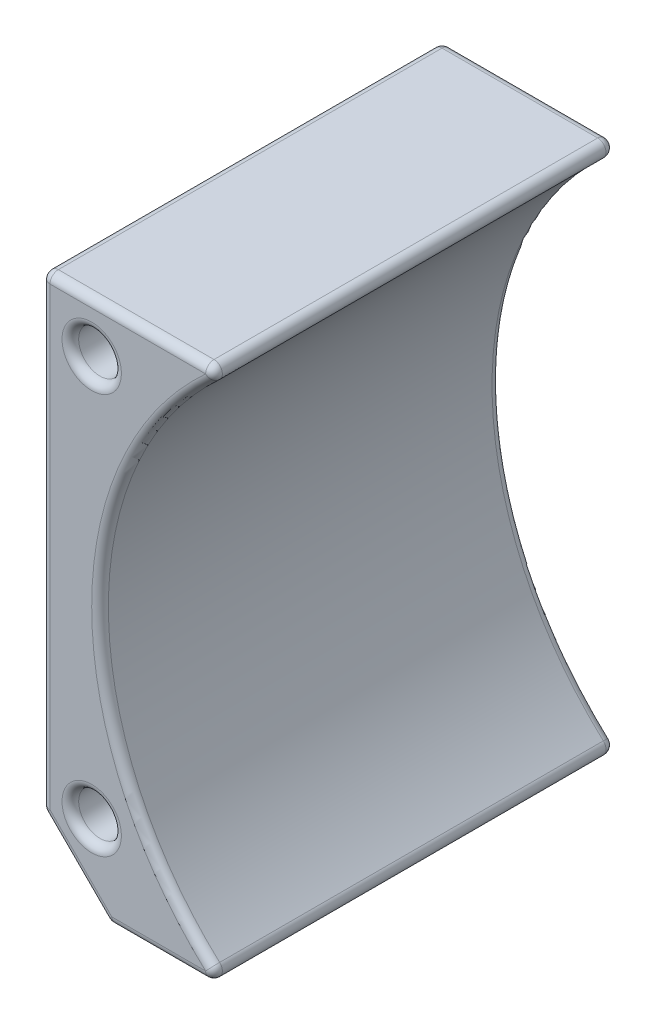
from build123d import *

# Parameters (mm, degrees)
BOSS_EXTRUDE1_DEPTH = 38.1
SKETCH2_R           = 2.032
CUT_EXTRUDE1_DEPTH  = 66.935388863
CHAMFER1_SIZE       = 6.35
FILLET1_R           = 0.79375


with BuildPart() as part:
    # Sketch1 → Boss-Extrude1 (new body)
    with BuildSketch(Plane.XY):
        with BuildLine():
            Line((0, 0), (17.754591081, 0))
            ThreePointArc((17.754591081, 0), (5.55625, 25.4), (17.754591081, 50.8))
            Line((17.754591081, 50.8), (0, 50.8))
            Line((0, 50.8), (0, 0))
        make_face()
    extrude(amount=BOSS_EXTRUDE1_DEPTH)

    # Sketch2 → Cut-Extrude1 (cut, through all)
    with BuildSketch(Plane.XY.offset(38.1)):
        with Locations((4.7625, 46.0375)):
            Circle(SKETCH2_R)
        with Locations((4.7625, 7.9375)):
            Circle(SKETCH2_R)
    extrude(amount=-CUT_EXTRUDE1_DEPTH, mode=Mode.SUBTRACT)

    # Chamfer1
    chamfer1_edges = [part.edges().sort_by_distance(p)[0] for p in [
        (0, 0, 19.05),
    ]]
    chamfer(chamfer1_edges, length=CHAMFER1_SIZE)

    # Fillet1
    fillet1_edges = [part.edges().sort_by_distance(p)[0] for p in [
        (3.175, 3.175, 38.1),
        (0, 6.35, 19.05),
        (3.175, 3.175, 0),
        (6.35, 0, 19.05),
        (17.754591081, 0, 19.05),
        (17.754591081, 50.8, 19.05),
        (0, 50.8, 19.05),
        (8.877295541, 50.8, 38.1),
        (5.55625, 25.4, 38.1),
        (12.052295541, 0, 38.1),
        (0, 28.575, 38.1),
        (8.877295541, 50.8, 0),
        (5.55625, 25.4, 0),
        (12.052295541, 0, 0),
        (0, 28.575, 0),
        (2.7305, 46.0375, 0),
        (2.7305, 46.0375, 38.1),
        (2.7305, 7.9375, 38.1),
        (2.7305, 7.9375, 0),
    ]]
    fillet(fillet1_edges, radius=FILLET1_R)


solid = part.part
